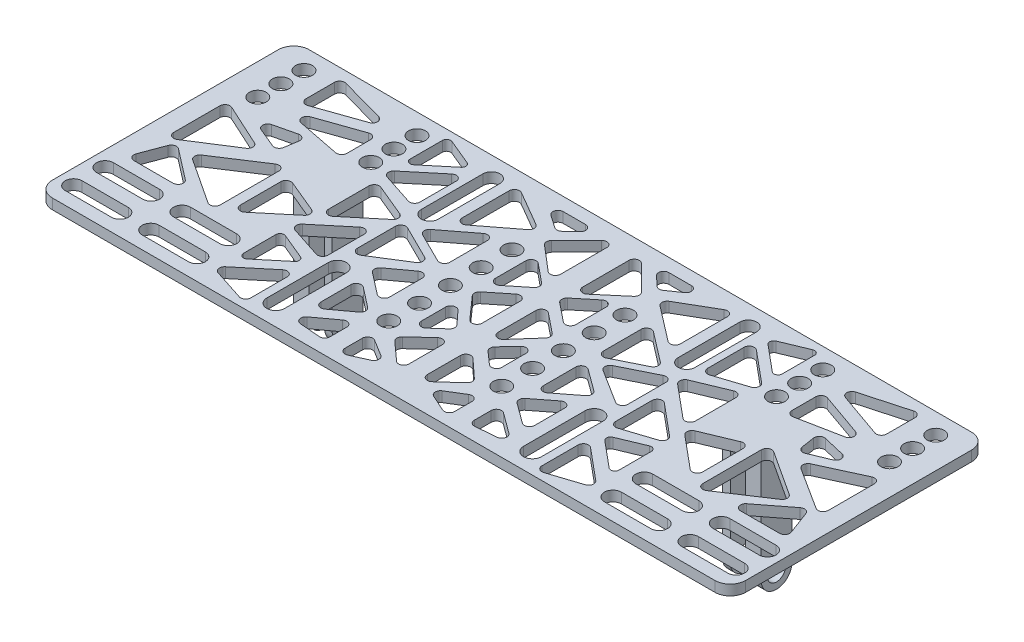
from build123d import *

# Parameters (mm, degrees)
SKETCH_1_W           = 135
SKETCH_1_H           = 50
EXTRUDE_1_DEPTH      = 2
CUT_EXTRUDE_1_DEPTH  = 73.008680032
CUT_EXTRUDE_2_DEPTH  = 73.008680032
SKETCH_4_R           = 1.65
CUT_EXTRUDE_3_DEPTH  = 73.008680032
SKETCH_5_W           = 1.5
SKETCH_5_H           = 6
SKETCH_5_W_2         = 3
EXTRUDE_2_DEPTH      = 24.5
FILLET_1_R           = 3
FILLET_3_R           = 3
CUT_EXTRUDE_8_DEPTH  = 77.703976429
CUT_EXTRUDE_9_DEPTH  = 77.703976429
SKETCH_6_R           = 1.75
CUT_EXTRUDE_10_DEPTH = 119.297294982
CHAMFER_1_SIZE       = 1
SKETCH_14_R          = 1.65
CUT_EXTRUDE_11_DEPTH = 77.703976429
CUT_EXTRUDE_12_DEPTH = 77.703976429


with BuildPart() as part:
    # 草图1 → 凸台-拉伸1 (new body)
    with BuildSketch(Plane(origin=(0, 0, 0), x_dir=(1, 0, 0), z_dir=(0, 1, 0))):
        Rectangle(SKETCH_1_W, SKETCH_1_H)
    extrude(amount=EXTRUDE_1_DEPTH)

    # 草图2 → 切除-拉伸1 (cut, through all)
    with BuildSketch(Plane(origin=(0, 2, 0), x_dir=(1, 0, 0), z_dir=(0, 1, 0))):
        with BuildLine():
            Line((-64.5, -19.2), (-55.5, -19.2))
            ThreePointArc((-55.5, -19.2), (-53.85, -20.85), (-55.5, -22.5))
            Line((-55.5, -22.5), (-64.5, -22.5))
            ThreePointArc((-64.5, -22.5), (-66.15, -20.85), (-64.5, -19.2))
        make_face()
        with BuildLine():
            Line((-64.5, -13.1), (-55.5, -13.1))
            ThreePointArc((-55.5, -13.1), (-53.85, -14.75), (-55.5, -16.4))
            Line((-55.5, -16.4), (-64.5, -16.4))
            ThreePointArc((-64.5, -16.4), (-66.15, -14.75), (-64.5, -13.1))
        make_face()
        with BuildLine():
            Line((-40.5, -19.2), (-49.5, -19.2))
            ThreePointArc((-49.5, -19.2), (-51.15, -20.85), (-49.5, -22.5))
            Line((-49.5, -22.5), (-40.5, -22.5))
            ThreePointArc((-40.5, -22.5), (-38.85, -20.85), (-40.5, -19.2))
        make_face()
        with BuildLine():
            Line((-40.5, -13.1), (-49.5, -13.1))
            ThreePointArc((-49.5, -13.1), (-51.15, -14.75), (-49.5, -16.4))
            Line((-49.5, -16.4), (-40.5, -16.4))
            ThreePointArc((-40.5, -16.4), (-38.85, -14.75), (-40.5, -13.1))
        make_face()
        with BuildLine():
            Line((64.5, -19.2), (55.5, -19.2))
            ThreePointArc((55.5, -19.2), (53.85, -20.85), (55.5, -22.5))
            Line((55.5, -22.5), (64.5, -22.5))
            ThreePointArc((64.5, -22.5), (66.15, -20.85), (64.5, -19.2))
        make_face()
        with BuildLine():
            Line((64.5, -13.1), (55.5, -13.1))
            ThreePointArc((55.5, -13.1), (53.85, -14.75), (55.5, -16.4))
            Line((55.5, -16.4), (64.5, -16.4))
            ThreePointArc((64.5, -16.4), (66.15, -14.75), (64.5, -13.1))
        make_face()
        with BuildLine():
            Line((40.5, -19.2), (49.5, -19.2))
            ThreePointArc((49.5, -19.2), (51.15, -20.85), (49.5, -22.5))
            Line((49.5, -22.5), (40.5, -22.5))
            ThreePointArc((40.5, -22.5), (38.85, -20.85), (40.5, -19.2))
        make_face()
        with BuildLine():
            Line((40.5, -13.1), (49.5, -13.1))
            ThreePointArc((49.5, -13.1), (51.15, -14.75), (49.5, -16.4))
            Line((49.5, -16.4), (40.5, -16.4))
            ThreePointArc((40.5, -16.4), (38.85, -14.75), (40.5, -13.1))
        make_face()
    extrude(amount=-CUT_EXTRUDE_1_DEPTH, mode=Mode.SUBTRACT)

    # 草图3 → 切除-拉伸2 (cut, through all)
    with BuildSketch(Plane(origin=(0, 2, 0), x_dir=(1, 0, 0), z_dir=(0, 1, 0))):
        with BuildLine():
            Line((-23.35, 21), (-23.35, 9))
            ThreePointArc((-23.35, 9), (-25, 7.35), (-26.65, 9))
            Line((-26.65, 9), (-26.65, 21))
            ThreePointArc((-26.65, 21), (-25, 22.65), (-23.35, 21))
        make_face()
        with BuildLine():
            Line((23.35, 21), (23.35, 9))
            ThreePointArc((23.35, 9), (25, 7.35), (26.65, 9))
            Line((26.65, 9), (26.65, 21))
            ThreePointArc((26.65, 21), (25, 22.65), (23.35, 21))
        make_face()
        with BuildLine():
            Line((-23.25, -9), (-23.25, -21))
            ThreePointArc((-23.25, -21), (-25, -22.75), (-26.75, -21))
            Line((-26.75, -21), (-26.75, -9))
            ThreePointArc((-26.75, -9), (-25, -7.25), (-23.25, -9))
        make_face()
        with BuildLine():
            Line((23.25, -9), (23.25, -21))
            ThreePointArc((23.25, -21), (25, -22.75), (26.75, -21))
            Line((26.75, -21), (26.75, -9))
            ThreePointArc((26.75, -9), (25, -7.25), (23.25, -9))
        make_face()
    extrude(amount=-CUT_EXTRUDE_2_DEPTH, mode=Mode.SUBTRACT)

    # 草图4 → 切除-拉伸3 (cut, through all)
    with BuildSketch(Plane(origin=(0, 2, 0), x_dir=(1, 0, 0), z_dir=(0, 1, 0))):
        with Locations(Location((-11, 11, 0), (0, 0, 270))):
            Circle(SKETCH_4_R)
        with Locations(Location((11, 11, 0), (0, 0, 90))):
            Circle(SKETCH_4_R)
        with Locations(Location((-11, 5, 0), (0, 0, 270))):
            Circle(SKETCH_4_R)
        with Locations(Location((11, 5, 0), (0, 0, 90))):
            Circle(SKETCH_4_R)
        with Locations(Location((-11, -1, 0), (0, 0, 270))):
            Circle(SKETCH_4_R)
        with Locations(Location((11, -1, 0), (0, 0, 90))):
            Circle(SKETCH_4_R)
        with Locations(Location((-11, -7, 0), (0, 0, 270))):
            Circle(SKETCH_4_R)
        with Locations(Location((11, -7, 0), (0, 0, 90))):
            Circle(SKETCH_4_R)
        with Locations(Location((-11, -13, 0), (0, 0, 270))):
            Circle(SKETCH_4_R)
        with Locations(Location((11, -13, 0), (0, 0, 90))):
            Circle(SKETCH_4_R)
    extrude(amount=-CUT_EXTRUDE_3_DEPTH, mode=Mode.SUBTRACT)

    # 草图5 → 凸台-拉伸2 (add)
    with BuildSketch(Plane.XZ):
        with Locations((-38.75, -6)):
            Rectangle(SKETCH_5_W, SKETCH_5_H)
        with Locations((-44, -6)):
            Rectangle(SKETCH_5_W_2, SKETCH_5_H)
        with Locations((44, -6)):
            Rectangle(SKETCH_5_W_2, SKETCH_5_H)
        with Locations((38.75, -6)):
            Rectangle(SKETCH_5_W, SKETCH_5_H)
    extrude(amount=EXTRUDE_2_DEPTH)

    # 圆角1
    fillet_1_edges = [part.edges().sort_by_distance(p)[0] for p in [
        (-44, -24.5, -3),
        (-44, -24.5, -9),
        (-38.75, -24.5, -9),
        (-38.75, -24.5, -3),
        (38.75, -24.5, -9),
        (38.75, -24.5, -3),
        (44, -24.5, -9),
        (44, -24.5, -3),
    ]]
    fillet(fillet_1_edges, radius=FILLET_1_R - 0.0001)  # a hair under: the kernel refuses the full size

    # 圆角3
    fillet_3_edges = [part.edges().sort_by_distance(p)[0] for p in [
        (67.5, 1, 25),
        (-67.5, 1, 25),
        (-67.5, 1, -25),
        (67.5, 1, -25),
    ]]
    fillet(fillet_3_edges, radius=FILLET_3_R)

    # 草图12 → 切除-拉伸8 (cut, through all)
    with BuildSketch(Plane(origin=(0, 2, 0), x_dir=(1, 0, 0), z_dir=(0, 1, 0))):
        with BuildLine():
            Line((-63.734074102, 6.831651994), (-63.734074102, -2.14560188))
            ThreePointArc((-63.734074102, -2.14560188), (-63.21431058, -3.022740937), (-62.195328252, -2.988070223))
            Line((-62.195328252, -2.988070223), (-54.02462453, 2.236972071))
            ThreePointArc((-54.02462453, 2.236972071), (-53.565765363, 3.148608541), (-54.146044292, 3.988197222))
            Line((-54.146044292, 3.988197222), (-62.316748014, 7.740408803))
            ThreePointArc((-62.316748014, 7.740408803), (-63.273830488, 7.67347326), (-63.734074102, 6.831651994))
        make_face()
        with BuildLine():
            Line((-57.235078223, -3.25409941), (-48.532404413, 2.429480449))
            ThreePointArc((-48.532404413, 2.429480449), (-47.509578035, 2.471651134), (-46.985601953, 1.5922188))
            Line((-46.985601953, 1.5922188), (-46.985601953, -9.824018357))
            ThreePointArc((-46.985601953, -9.824018357), (-47.511312771, -10.704387468), (-48.535701497, -10.659117448))
            Line((-48.535701497, -10.659117448), (-57.238375307, -4.926460151))
            ThreePointArc((-57.238375307, -4.926460151), (-57.68827382, -4.089389549), (-57.235078223, -3.25409941))
        make_face()
        with BuildLine():
            Line((-60.531869256, -4.412045599), (-54.642348672, -8.971490406))
            ThreePointArc((-54.642348672, -8.971490406), (-54.308267633, -10.085695031), (-55.254506416, -10.762226074))
            Line((-55.254506416, -10.762226074), (-62.853164133, -10.762226074))
            ThreePointArc((-62.853164133, -10.762226074), (-63.675053896, -10.331872646), (-63.789537506, -9.411220509))
            Line((-63.789537506, -9.411220509), (-62.080400373, -4.851775702))
            ThreePointArc((-62.080400373, -4.851775702), (-61.417192855, -4.240814315), (-60.531869256, -4.412045599))
        make_face()
        with BuildLine():
            Line((-45.004601654, -0.013720354), (-45.004601654, -7.895360983))
            ThreePointArc((-45.004601654, -7.895360983), (-44.428842026, -8.800910599), (-43.36456144, -8.663702395))
            Line((-43.36456144, -8.663702395), (-37.056842269, -3.409275309))
            ThreePointArc((-37.056842269, -3.409275309), (-36.708103556, -2.4915477), (-37.312392148, -1.71780488))
            Line((-37.312392148, -1.71780488), (-43.620111319, 0.909408663))
            ThreePointArc((-43.620111319, 0.909408663), (-44.559358207, 0.818292367), (-45.004601654, -0.013720354))
        make_face()
        with BuildLine():
            Line((-35.760611443, 12.844838241), (-29.661226975, 17.925719315))
            ThreePointArc((-29.661226975, 17.925719315), (-28.596946389, 18.062927519), (-28.021186761, 17.157377903))
            Line((-28.021186761, 17.157377903), (-28.021186761, 10.087479271))
            ThreePointArc((-28.021186761, 10.087479271), (-28.43383379, 9.278148382), (-29.331219737, 9.136753467))
            Line((-29.331219737, 9.136753467), (-35.430604206, 11.125771025))
            ThreePointArc((-35.430604206, 11.125771025), (-36.102639348, 11.88797041), (-35.760611443, 12.844838241))
        make_face()
        with BuildLine():
            Line((-36.070644419, -19.760712148), (-29.97125995, -14.679831074))
            ThreePointArc((-29.97125995, -14.679831074), (-28.906979365, -14.54262287), (-28.331219737, -15.448172486))
            Line((-28.331219737, -15.448172486), (-28.331219737, -22.518071118))
            ThreePointArc((-28.331219737, -22.518071118), (-28.743866766, -23.327402007), (-29.641252712, -23.468796922))
            Line((-29.641252712, -23.468796922), (-35.740637181, -21.479779364))
            ThreePointArc((-35.740637181, -21.479779364), (-36.412672324, -20.717579979), (-36.070644419, -19.760712148))
        make_face()
        with BuildLine():
            Line((-36.560611443, -9.411220509), (-36.560611443, -15.716533012))
            ThreePointArc((-36.560611443, -15.716533012), (-36.100003741, -16.440972705), (-35.248579273, -16.331206141))
            Line((-35.248579273, -16.331206141), (-30.202403935, -12.127664473))
            ThreePointArc((-30.202403935, -12.127664473), (-29.923412966, -11.393482386), (-30.406843838, -10.774488129))
            Line((-30.406843838, -10.774488129), (-35.453019176, -8.672717295))
            ThreePointArc((-35.453019176, -8.672717295), (-36.204416686, -8.745610332), (-36.560611443, -9.411220509))
        make_face()
        with BuildLine():
            Line((-34.918572035, 15.767862393), (-29.872396698, 19.971404062))
            ThreePointArc((-29.872396698, 19.971404062), (-29.593405728, 20.705586149), (-30.076836601, 21.324580405))
            Line((-30.076836601, 21.324580405), (-35.123011938, 23.426351239))
            ThreePointArc((-35.123011938, 23.426351239), (-35.874409448, 23.353458202), (-36.230604206, 22.687848025))
            Line((-36.230604206, 22.687848025), (-36.230604206, 16.382535522))
            ThreePointArc((-36.230604206, 16.382535522), (-35.769996503, 15.65809583), (-34.918572035, 15.767862393))
        make_face()
        with BuildLine():
            Line((-35.716955735, 7.867920275), (-35.716955735, -0.013720354))
            ThreePointArc((-35.716955735, -0.013720354), (-35.141196107, -0.91926997), (-34.076915522, -0.782061766))
            Line((-34.076915522, -0.782061766), (-27.76919635, 4.47236532))
            ThreePointArc((-27.76919635, 4.47236532), (-27.420457638, 5.390092929), (-28.024746229, 6.163835749))
            Line((-28.024746229, 6.163835749), (-34.332465401, 8.791049292))
            ThreePointArc((-34.332465401, 8.791049292), (-35.271712288, 8.699932996), (-35.716955735, 7.867920275))
        make_face()
        with BuildLine():
            Line((-55.686348248, 6.831651994), (-51.866622227, 5.240706732))
            ThreePointArc((-51.866622227, 5.240706732), (-50.994005948, 5.291062547), (-50.494315391, 6.008212618))
            Line((-50.494315391, 6.008212618), (-50.086633347, 8.595970927))
            ThreePointArc((-50.086633347, 8.595970927), (-50.394463952, 9.484819249), (-51.303953573, 9.724901841))
            Line((-51.303953573, 9.724901841), (-55.531361638, 8.728088795))
            ThreePointArc((-55.531361638, 8.728088795), (-56.298535048, 7.836234615), (-55.686348248, 6.831651994))
        make_face()
        with BuildLine():
            Line((-35.760611443, -5.075269628), (-29.661226975, 0.005611446))
            ThreePointArc((-29.661226975, 0.005611446), (-28.596946389, 0.14281965), (-28.021186761, -0.762729965))
            Line((-28.021186761, -0.762729965), (-28.021186761, -7.832628598))
            ThreePointArc((-28.021186761, -7.832628598), (-28.43383379, -8.641959486), (-29.331219737, -8.783354401))
            Line((-29.331219737, -8.783354401), (-35.430604206, -6.794336843))
            ThreePointArc((-35.430604206, -6.794336843), (-36.102639348, -6.032137459), (-35.760611443, -5.075269628))
        make_face()
    cut_extrude_8 = extrude(amount=-CUT_EXTRUDE_8_DEPTH, mode=Mode.SUBTRACT)

    # 草图13 → 切除-拉伸9 (cut, through all)
    with BuildSketch(Plane(origin=(0, 2, 0), x_dir=(1, 0, 0), z_dir=(0, 1, 0))):
        with BuildLine():
            Line((-26.32841963, 3.643420488), (-26.32841963, -3.778151031))
            ThreePointArc((-26.32841963, -3.778151031), (-25.811643201, -4.653648022), (-24.795429669, -4.624272595))
            Line((-24.795429669, -4.624272595), (-18.204243774, -0.472344473))
            ThreePointArc((-18.204243774, -0.472344473), (-17.738524726, 0.424573885), (-18.292843888, 1.269610593))
            Line((-18.292843888, 1.269610593), (-24.884029783, 4.53925399))
            ThreePointArc((-24.884029783, 4.53925399), (-25.855491804, 4.493241012), (-26.32841963, 3.643420488))
        make_face()
        with BuildLine():
            Line((-22.215274528, 4.81437871), (-16.406548914, 1.932884902))
            ThreePointArc((-16.406548914, 1.932884902), (-15.435086893, 1.97889788), (-14.962159067, 2.828718404))
            Line((-14.962159067, 2.828718404), (-14.962159067, 10.175289238))
            ThreePointArc((-14.962159067, 10.175289238), (-15.520253308, 11.072350719), (-16.571597668, 10.968122506))
            Line((-16.571597668, 10.968122506), (-22.380323281, 6.503045481))
            ThreePointArc((-22.380323281, 6.503045481), (-22.766142167, 5.612936651), (-22.215274528, 4.81437871))
        make_face()
        with BuildLine():
            Line((-19.634017925, 10.752073679), (-12.851890732, 15.965389358))
            ThreePointArc((-12.851890732, 15.965389358), (-12.463407657, 16.822661193), (-12.95891763, 17.622851148))
            Line((-12.95891763, 17.622851148), (-19.741044823, 21.563757538))
            ThreePointArc((-19.741044823, 21.563757538), (-20.742249217, 21.565850339), (-21.243456526, 20.699129016))
            Line((-21.243456526, 20.699129016), (-21.243456526, 11.544906947))
            ThreePointArc((-21.243456526, 11.544906947), (-20.685362284, 10.647845467), (-19.634017925, 10.752073679))
        make_face()
        with BuildLine():
            Line((-20.745433527, -4.806594091), (-16.554551135, -1.725049957))
            ThreePointArc((-16.554551135, -1.725049957), (-15.510712541, -1.638401604), (-14.962159067, -2.53069978))
            Line((-14.962159067, -2.53069978), (-14.962159067, -8.8711078))
            ThreePointArc((-14.962159067, -8.8711078), (-15.522760117, -9.769399825), (-16.576016193, -9.660524944))
            Line((-16.576016193, -9.660524944), (-20.766898585, -6.401661059))
            ThreePointArc((-20.766898585, -6.401661059), (-21.152950924, -5.598787981), (-20.745433527, -4.806594091))
        make_face()
        with BuildLine():
            Line((-19.202554479, -9.757164414), (-15.332427174, -12.766606561))
            ThreePointArc((-15.332427174, -12.766606561), (-14.946374836, -13.569479639), (-15.353892232, -14.361673529))
            Line((-15.353892232, -14.361673529), (-19.224019538, -17.207367343))
            ThreePointArc((-19.224019538, -17.207367343), (-20.267858132, -17.294015695), (-20.816411606, -16.40171752))
            Line((-20.816411606, -16.40171752), (-20.816411606, -10.546581558))
            ThreePointArc((-20.816411606, -10.546581558), (-20.255810555, -9.648289533), (-19.202554479, -9.757164414))
        make_face()
        with BuildLine():
            Line((-19.659893025, -20.254964755), (-15.649320454, -17.306001929))
            ThreePointArc((-15.649320454, -17.306001929), (-14.60548186, -17.219353576), (-14.056928386, -18.111651752))
            Line((-14.056928386, -18.111651752), (-14.056928386, -21.393281697))
            ThreePointArc((-14.056928386, -21.393281697), (-14.379677934, -22.129034254), (-15.139592036, -22.3898592))
            Line((-15.139592036, -22.3898592), (-19.150164607, -22.057192082))
            ThreePointArc((-19.150164607, -22.057192082), (-20.029753985, -21.332770985), (-19.659893025, -20.254964755))
        make_face()
        with BuildLine():
            Line((-12.468613943, 22.436767394), (-8.104090394, 22.436767394))
            ThreePointArc((-8.104090394, 22.436767394), (-7.173170525, 21.801990884), (-7.424102786, 20.70354379))
            Line((-7.424102786, 20.70354379), (-9.29060424, 18.972560427))
            ThreePointArc((-9.29060424, 18.972560427), (-9.899764852, 18.708295416), (-10.540153983, 18.883835751))
            Line((-10.540153983, 18.883835751), (-13.038176078, 20.614819114))
            ThreePointArc((-13.038176078, 20.614819114), (-13.423063596, 21.73513941), (-12.468613943, 22.436767394))
        make_face()
        with BuildLine():
            Line((-8.728754124, 16.458240862), (-3.863914498, 21.323080487))
            ThreePointArc((-3.863914498, 21.323080487), (-2.774124285, 21.539853238), (-2.156807717, 20.615973706))
            Line((-2.156807717, 20.615973706), (-2.156807717, 11.616020399))
            ThreePointArc((-2.156807717, 11.616020399), (-2.737074719, 10.708372774), (-3.804456137, 10.854081081))
            Line((-3.804456137, 10.854081081), (-8.669295763, 14.989194763))
            ThreePointArc((-8.669295763, 14.989194763), (-9.02082927, 15.710693062), (-8.728754124, 16.458240862))
        make_face()
        with BuildLine():
            Line((-6.182358886, 11.291004241), (-2.539617647, 8.296547461))
            ThreePointArc((-2.539617647, 8.296547461), (-2.174649246, 7.518951195), (-2.547529137, 6.745117574))
            Line((-2.547529137, 6.745117574), (-6.190270376, 3.81240217))
            ThreePointArc((-6.190270376, 3.81240217), (-7.249171932, 3.689363172), (-7.817377482, 4.591335207))
            Line((-7.817377482, 4.591335207), (-7.817377482, 10.518507392))
            ThreePointArc((-7.817377482, 10.518507392), (-7.244566787, 11.4226696), (-6.182358886, 11.291004241))
        make_face()
        with BuildLine():
            Line((-7.000451718, 0.831866833), (-3.174636244, 3.911972511))
            ThreePointArc((-3.174636244, 3.911972511), (-2.115734688, 4.035011509), (-1.547529137, 3.133039474))
            Line((-1.547529137, 3.133039474), (-1.547529137, -4.261554286))
            ThreePointArc((-1.547529137, -4.261554286), (-2.192711099, -5.196489663), (-3.295737457, -4.925018158))
            Line((-3.295737457, -4.925018158), (-7.121552931, -0.610530077))
            ThreePointArc((-7.121552931, -0.610530077), (-7.369838636, 0.136597754), (-7.000451718, 0.831866833))
        make_face()
        with BuildLine():
            Line((-7.817377482, -5.115418128), (-7.817377482, -9.802251493))
            ThreePointArc((-7.817377482, -9.802251493), (-7.227582387, -10.714244879), (-6.15391361, -10.550459814))
            Line((-6.15391361, -10.550459814), (-3.776003869, -8.441879673))
            ThreePointArc((-3.776003869, -8.441879673), (-3.440726503, -7.743830497), (-3.704377843, -7.015701706))
            Line((-3.704377843, -7.015701706), (-6.082287584, -4.437448481))
            ThreePointArc((-6.082287584, -4.437448481), (-7.181321229, -4.183997198), (-7.817377482, -5.115418128))
        make_face()
        with BuildLine():
            Line((-7.011793916, -14.33986995), (-3.463727746, -11.067506696))
            ThreePointArc((-3.463727746, -11.067506696), (-2.384491135, -10.886635447), (-1.785758099, -11.802596594))
            Line((-1.785758099, -11.802596594), (-1.785758099, -18.278108515))
            ThreePointArc((-1.785758099, -18.278108515), (-2.379622001, -19.191921116), (-3.455865038, -19.020373083))
            Line((-3.455865038, -19.020373083), (-7.003931209, -15.817224416))
            ThreePointArc((-7.003931209, -15.817224416), (-7.333810107, -15.080281925), (-7.011793916, -14.33986995))
        make_face()
        with BuildLine():
            Line((-10.673294277, -18.46206955), (-10.673294277, -21.841222964))
            ThreePointArc((-10.673294277, -21.841222964), (-10.217120529, -22.6804208), (-9.264788262, -22.753978592))
            Line((-9.264788262, -22.753978592), (-6.085716299, -21.331177154))
            ThreePointArc((-6.085716299, -21.331177154), (-5.496361384, -20.483794028), (-5.970124889, -19.56676321))
            Line((-5.970124889, -19.56676321), (-9.149196851, -17.610411233))
            ThreePointArc((-9.149196851, -17.610411233), (-10.161096785, -17.589115535), (-10.673294277, -18.46206955))
        make_face()
    cut_extrude_9 = extrude(amount=-CUT_EXTRUDE_9_DEPTH, mode=Mode.SUBTRACT)

    # 镜向1: 切除-拉伸8, 切除-拉伸9 across plane
    add(cut_extrude_8.mirror(Plane(origin=(0, 0, 0), x_dir=(0, 0, 1), z_dir=(1, 0, 0))), mode=Mode.SUBTRACT)
    add(cut_extrude_9.mirror(Plane(origin=(0, 0, 0), x_dir=(0, 0, 1), z_dir=(1, 0, 0))), mode=Mode.SUBTRACT)

    # 草图6 → 切除-拉伸10 (cut, through all)
    with BuildSketch(Plane(origin=(45.5, 0, 0), x_dir=(0, 0, -1), z_dir=(1, 0, 0))):
        with Locations((6, -21.5)):
            Circle(SKETCH_6_R)
    extrude(amount=-CUT_EXTRUDE_10_DEPTH, mode=Mode.SUBTRACT)

    # 倒角1
    chamfer_1_edges = [part.edges().sort_by_distance(p)[0] for p in [
        (-38, 0, -6),
        (-45.5, 0, -6),
        (45.5, 0, -6),
        (38, 0, -6),
    ]]
    chamfer(chamfer_1_edges, length=CHAMFER_1_SIZE)

    # 草图14 → 切除-拉伸11 (cut, through all)
    with BuildSketch(Plane(origin=(0, 2, 0), x_dir=(1, 0, 0), z_dir=(0, 1, 0))):
        with Locations(Location((-61.5, 21, 0), (0, 0, 270))):
            Circle(SKETCH_14_R)
        with Locations(Location((-39.5, 21, 0), (0, 0, 270))):
            Circle(SKETCH_14_R)
        with Locations(Location((39.5, 21, 0), (0, 0, 90))):
            Circle(SKETCH_14_R)
        with Locations(Location((61.5, 21, 0), (0, 0, 90))):
            Circle(SKETCH_14_R)
        with Locations(Location((-61.5, 16.5, 0), (0, 0, 270))):
            Circle(SKETCH_14_R)
        with Locations(Location((-39.5, 16.5, 0), (0, 0, 270))):
            Circle(SKETCH_14_R)
        with Locations(Location((39.5, 16.5, 0), (0, 0, 90))):
            Circle(SKETCH_14_R)
        with Locations(Location((61.5, 16.5, 0), (0, 0, 90))):
            Circle(SKETCH_14_R)
        with Locations(Location((-61.5, 12, 0), (0, 0, 270))):
            Circle(SKETCH_14_R)
        with Locations(Location((-39.5, 12, 0), (0, 0, 270))):
            Circle(SKETCH_14_R)
        with Locations(Location((39.5, 12, 0), (0, 0, 90))):
            Circle(SKETCH_14_R)
        with Locations(Location((61.5, 12, 0), (0, 0, 90))):
            Circle(SKETCH_14_R)
    cut_extrude_11 = extrude(amount=-CUT_EXTRUDE_11_DEPTH, mode=Mode.SUBTRACT)

    # 草图15 → 切除-拉伸12 (cut, through all)
    with BuildSketch(Plane(origin=(0, 2, 0), x_dir=(1, 0, 0), z_dir=(0, 1, 0))):
        with BuildLine():
            Line((-56.534211613, 21.958590845), (-56.534211613, 16.402715627))
            ThreePointArc((-56.534211613, 16.402715627), (-56.112515282, 15.586894037), (-55.20308188, 15.459130389))
            Line((-55.20308188, 15.459130389), (-46.354191049, 18.564446941))
            ThreePointArc((-46.354191049, 18.564446941), (-45.685887516, 19.541694449), (-46.418431928, 20.471759494))
            Line((-46.418431928, 20.471759494), (-55.267322759, 22.922318161))
            ThreePointArc((-55.267322759, 22.922318161), (-56.139649944, 22.754483066), (-56.534211613, 21.958590845))
        make_face()
        with BuildLine():
            Line((-53.08894628, 13.796747818), (-44.675862529, 16.749127808))
            ThreePointArc((-44.675862529, 16.749127808), (-43.766429127, 16.62136416), (-43.344732797, 15.80554257))
            Line((-43.344732797, 15.80554257), (-43.344732797, 11.18700174))
            ThreePointArc((-43.344732797, 11.18700174), (-43.710016663, 10.414256355), (-44.539003657, 10.206053814))
            Line((-44.539003657, 10.206053814), (-52.952087408, 11.872214655))
            ThreePointArc((-52.952087408, 11.872214655), (-53.755297585, 12.782228947), (-53.08894628, 13.796747818))
        make_face()
    cut_extrude_12 = extrude(amount=-CUT_EXTRUDE_12_DEPTH, mode=Mode.SUBTRACT)

    # 镜向2: 切除-拉伸11, 切除-拉伸12 across plane
    add(cut_extrude_11.mirror(Plane(origin=(0, 0, 0), x_dir=(0, 0, 1), z_dir=(1, 0, 0))), mode=Mode.SUBTRACT)
    add(cut_extrude_12.mirror(Plane(origin=(0, 0, 0), x_dir=(0, 0, 1), z_dir=(1, 0, 0))), mode=Mode.SUBTRACT)


solid = part.part
